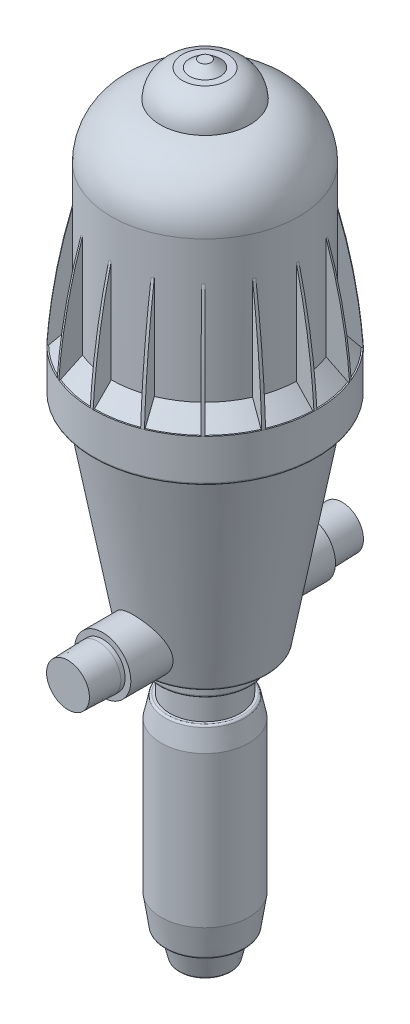
from build123d import *

# Parameters (mm, degrees)
FILLET1_R                = 33.02
REVOLVE2_ANGLE           = 1.5
CIRPATTERN1_COUNT        = 16
FILLET3_R                = 1.27
BOSS_EXTRUDE1_DEPTH      = 60.96
BOSS_EXTRUDE1_DEPTH_BACK = 60.96
SKETCH3_R                = 16.764
SKETCH4_R                = 13.208
BOSS_EXTRUDE2_DEPTH      = 19.05
BOSS_EXTRUDE2_TAPER      = 2


with BuildPart() as part:
    # Sketch1 → Revolve1 (revolve)
    with BuildSketch(Plane.XY, mode=Mode.PRIVATE) as revolve1_sk:
        with BuildLine():
            Line((55.88, 65.446656), (55.88, -51.553344))
            Line((55.88, -51.553344), (65.88, -61.553344))
            Line((65.88, -61.553344), (66.675, -61.553344))
            Line((66.675, -61.553344), (66.675, -86.953344))
            Line((66.675, -86.953344), (59.436, -86.953344))
            Line((59.436, -86.953344), (36.5125, -213.953344))
            Line((36.5125, -213.953344), (27.051, -213.953344))
            Line((27.051, -213.953344), (27.051, -224.621344))
            Line((27.051, -224.621344), (20.955, -224.621344))
            Line((20.955, -224.621344), (20.955, -241.131344))
            Line((20.955, -241.131344), (23.495, -241.131344))
            Line((23.495, -241.131344), (26.162, -253.831344))
            Line((26.162, -253.831344), (26.162, -343.747344))
            Line((26.162, -343.747344), (23.495, -361.781344))
            Line((23.495, -361.781344), (19.304, -361.781344))
            Line((19.304, -361.781344), (15.24, -377.783344))
            Line((15.24, -377.783344), (0, -377.783344))
            Line((0, -377.783344), (0, 86.020656))
            Line((0, 86.020656), (3.548199319, 86.020656))
            Line((3.548199319, 86.020656), (9.144, 81.702656))
            Line((9.144, 81.702656), (13.503244919, 81.702656))
            add(Edge.make_bspline(
                [(13.503244919, 81.702656), (25.676840888, 78.324945227), (26.67, 65.446656)],
                knots=[0, 0, 0, 1, 1, 1], degree=2))
            Line((26.67, 65.446656), (55.88, 65.446656))
        make_face()
    revolve(revolve1_sk.sketch.rotate(Axis((0, 86.020656, 0), (0, -1, 0)), 180), axis=Axis((0, 86.020656, 0), (0, -1, 0)))

    # Fillet1
    # the kernel refuses this fillet: 33.02 mm, written as the material it takes off along each edge
    with BuildSketch(Plane(origin=(0, 65.446656, 0), x_dir=(-1, 0, 0), z_dir=(0, 0, 1))) as fillet1_piece_1:
        with BuildLine():
            CenterArc((22.86, 32.799455788), FILLET1_R, 276.625809565, 83.374190435)
            Line((26.67, 0), (26.7462, -0.655989116))
            ThreePointArc((26.7462, -0.655989116), (41.275, -0.6604), (55.88, -0.6604))
            Line((55.88, -0.6604), (56.5404, 0))
            Line((56.5404, 0), (56.5404, 32.799455788))
            Line((56.5404, 32.799455788), (55.88, 32.799455788))
        make_face()
    revolve(axis=Axis((0, 65.446656, 0), (0, -1, 0)), mode=Mode.SUBTRACT)

    # Sketch2 → Revolve2 (revolve)
    with BuildSketch(Plane.XY):
        with BuildLine():
            Line((-66.675, -61.553344), (-65.88, -61.553344))
            Line((-65.88, -61.553344), (-55.88, -51.553344))
            Line((-55.88, -51.553344), (-55.88, 9.566656))
            add(Edge.make_bspline(
                [(-55.88, 9.566656), (-64.507556599, -25.535112163), (-66.675, -61.553344)],
                knots=[0, 0, 0, 1, 1, 1], degree=2))
        make_face()
    revolve2 = revolve(axis=Axis((0, 86.020656, 0), (0, -1, 0)), revolution_arc=REVOLVE2_ANGLE)

    # CirPattern1: Revolve2 ×16 about axis
    cirpattern1_axis = Axis((0, -51.553344, 0), (0, 1, 0))
    for i in range(1, CIRPATTERN1_COUNT):
        add(revolve2.rotate(cirpattern1_axis, i * 360 / CIRPATTERN1_COUNT))

    # Fillet3
    fillet3_edges = [part.edges().sort_by_distance(p)[0] for p in [
        (66.675, -86.953344, 0),
        (36.5125, -213.953344, 0),
        (27.051, -213.953344, 0),
        (27.051, -224.621344, 0),
        (23.495, -241.131344, 0),
        (23.495, -361.781344, 0),
        (15.24, -377.783344, 0),
    ]]
    fillet(fillet3_edges, radius=FILLET3_R)

    # Sketch3 → Boss-Extrude1 (add, two sides: drawn at the far end of the back side and taken through both)
    with BuildSketch(Plane.XY.offset(-BOSS_EXTRUDE1_DEPTH_BACK)):
        with Locations((0, -196.144933572)):
            Circle(SKETCH3_R)
    extrude(amount=BOSS_EXTRUDE1_DEPTH + BOSS_EXTRUDE1_DEPTH_BACK)

    # Sketch6 → Revolve3 (revolve)
    with BuildSketch(Plane(origin=(0, 0, 0), x_dir=(0, 0, -1), z_dir=(1, 0, 0)), mode=Mode.PRIVATE) as revolve3_sk:
        Polygon((-60.96, -196.144933572), (-81.642857143, -196.144933572), (-81.642857143, -183.376897858), (-63.5, -182.809933572), (-60.96, -182.809933572), align=None)
    revolve3 = revolve(revolve3_sk.sketch.rotate(Axis((0, -196.144933572, 60.96), (0, 0, 1)), 270), axis=Axis((0, -196.144933572, 60.96), (0, 0, 1)))

    # Sketch4 → Boss-Extrude2 (add)
    with BuildSketch(Plane.XY.offset(60.96)):
        with Locations((0, -196.144933572)):
            Circle(SKETCH4_R)
    extrude(amount=BOSS_EXTRUDE2_DEPTH, taper=BOSS_EXTRUDE2_TAPER)

    # Mirror1: Revolve3 across plane
    add(revolve3.mirror(Plane.XY))


solid = part.part
